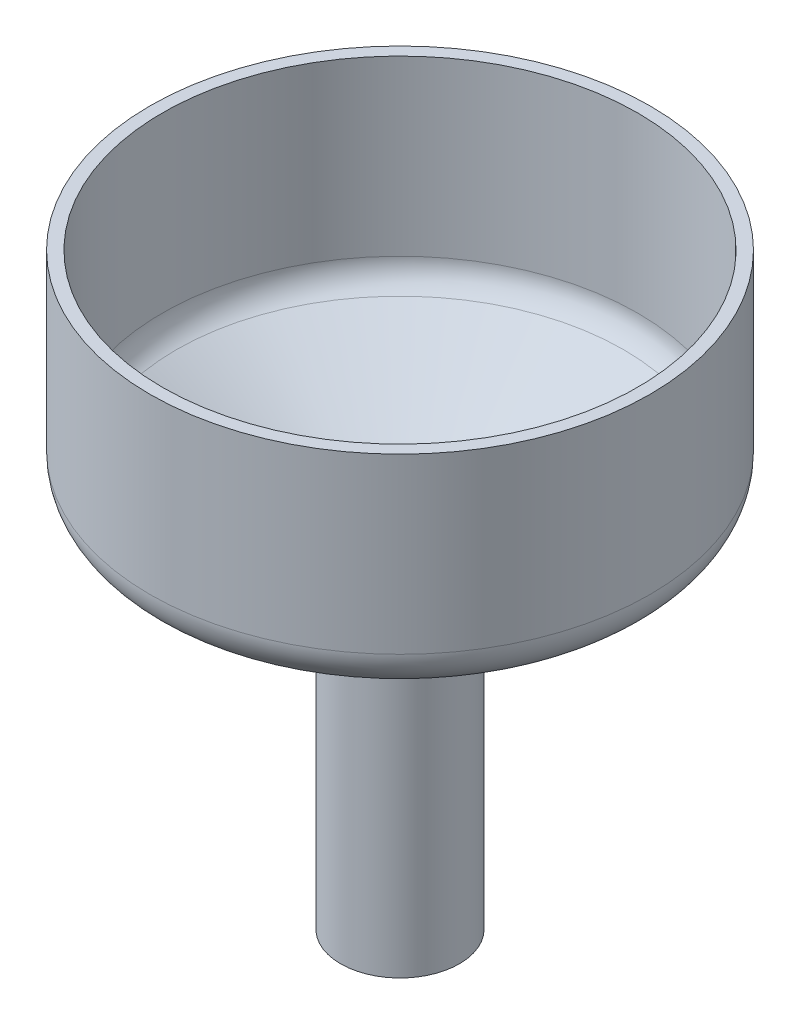
from build123d import *

# Parameters (mm, degrees)
CROQUIS1_R              = 7.25
SALIENTE_EXTRUIR1_DEPTH = 34
CROQUIS2_R              = 30.5
SALIENTE_EXTRUIR2_DEPTH = 24
CROQUIS3_R              = 7.25
CROQUIS2_2_R            = 30.5
REDONDEO1_R             = 5
VACIADO1_T              = -1.5


with BuildPart() as part:
    # Croquis1 → Saliente-Extruir1 (new body)
    with BuildSketch(Plane(origin=(0, 0, 0), x_dir=(1, 0, 0), z_dir=(0, 1, 0))):
        Circle(CROQUIS1_R)
    extrude(amount=SALIENTE_EXTRUIR1_DEPTH)



with BuildPart() as body_2:
    # Croquis2 → Saliente-Extruir2 (new body)
    with BuildSketch(Plane(origin=(0, 47.8, 0), x_dir=(1, 0, 0), z_dir=(0, 1, 0))):
        Circle(CROQUIS2_R)
    extrude(amount=SALIENTE_EXTRUIR2_DEPTH)


with BuildPart() as part_1:
    add(part.part)

    add(body_2.part)  # Recubrir1 merges body 2
    # Croquis3 → Recubrir1 section 0
    with BuildSketch(Plane(origin=(0, 34, 0), x_dir=(1, 0, 0), z_dir=(0, 1, 0))):
        Circle(CROQUIS3_R)
    # Croquis2<2> → Recubrir1 section 1
    with BuildSketch(Plane(origin=(0, 47.8, 0), x_dir=(1, 0, 0), z_dir=(0, 1, 0))):
        Circle(CROQUIS2_2_R)
    loft()

    # Redondeo1
    redondeo1_edges = [part_1.edges().sort_by_distance(p)[0] for p in [
        (-30.5, 47.8, 0),
    ]]
    fillet(redondeo1_edges, radius=REDONDEO1_R)

    # Vaciado1
    vaciado1_openings = [part_1.faces().sort_by_distance(p)[0] for p in [
        (0, 0, 0),
        (0, 71.8, 0),
    ]]
    offset(amount=VACIADO1_T, openings=vaciado1_openings, kind=Kind.INTERSECTION)


solid = part_1.part
